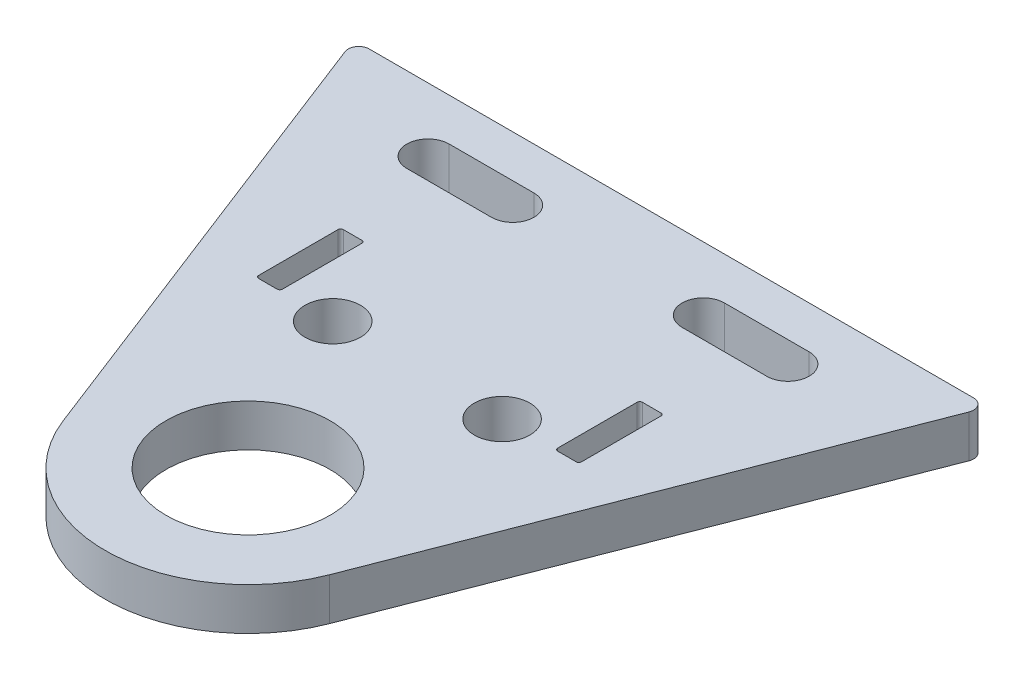
from build123d import *

# Parameters (mm, degrees)
BASE_FLANGE1_DEPTH = 12.7
SKETCH2_R          = 24.60625
SKETCH2_R_2        = 8.3312
CUT_EXTRUDE1_DEPTH = 196.159220654
CUT_EXTRUDE2_DEPTH = 196.159220654
FILLET1_R          = 3.175
SKETCH8_W          = 7.14375
SKETCH8_H          = 25.4
CUT_EXTRUDE3_DEPTH = 195.449637912
FILLET2_R          = 0.79375


# Sheet-metal steps are written as plain solids
with BuildPart() as part:
    # Sketch1 → Base-Flange1 (new body)
    with BuildSketch(Plane(origin=(0, 0, 0), x_dir=(1, 0, 0), z_dir=(0, 1, 0))):
        with BuildLine():
            Line((-95.25, 0), (95.25, 0))
            Line((95.25, 0), (39.960205447, -142.504060335))
            ThreePointArc((39.960205447, -142.504060335), (0, -169.8625), (-39.960205447, -142.504060335))
            Line((-39.960205447, -142.504060335), (-95.25, 0))
        make_face()
    extrude(amount=-BASE_FLANGE1_DEPTH)

    # Sketch2 → Cut-Extrude1 (cut, through all)
    with BuildSketch(Plane(origin=(0, 0, 0), x_dir=(1, 0, 0), z_dir=(0, 1, 0))):
        with Locations(Location((0, -127, 0), (0, 0, 270))):
            Circle(SKETCH2_R)
        with Locations(Location((-25.4, -76.2, 0), (0, 0, 270))):
            Circle(SKETCH2_R_2)
        with Locations(Location((25.4, -76.2, 0), (0, 0, 270))):
            Circle(SKETCH2_R_2)
    extrude(amount=-CUT_EXTRUDE1_DEPTH, mode=Mode.SUBTRACT)

    # Sketch7 → Cut-Extrude2 (cut, through all)
    with BuildSketch(Plane(origin=(0, 0, 0), x_dir=(1, 0, 0), z_dir=(0, 1, 0))):
        with BuildLine():
            Line((53.975, -25.4), (28.575, -25.4))
            ThreePointArc((28.575, -25.4), (22.225, -19.05), (28.575, -12.7))
            Line((28.575, -12.7), (53.975, -12.7))
            ThreePointArc((53.975, -12.7), (60.325, -19.05), (53.975, -25.4))
        make_face()
        with BuildLine():
            Line((-28.575, -25.4), (-53.975, -25.4))
            ThreePointArc((-53.975, -25.4), (-60.325, -19.05), (-53.975, -12.7))
            Line((-53.975, -12.7), (-28.575, -12.7))
            ThreePointArc((-28.575, -12.7), (-22.225, -19.05), (-28.575, -25.4))
        make_face()
    extrude(amount=-CUT_EXTRUDE2_DEPTH, mode=Mode.SUBTRACT)

    # Fillet1
    fillet1_edges = [part.edges().sort_by_distance(p)[0] for p in [
        (-95.25, -6.35, 0),
        (95.25, -6.35, 0),
    ]]
    fillet(fillet1_edges, radius=FILLET1_R)

    # Sketch8 → Cut-Extrude3 (cut, through all)
    with BuildSketch(Plane(origin=(0, 0, 0), x_dir=(1, 0, 0), z_dir=(0, 1, 0))):
        with Locations((44.846875, -63.5)):
            Rectangle(SKETCH8_W, SKETCH8_H)
        with Locations((-44.846875, -63.5)):
            Rectangle(SKETCH8_W, SKETCH8_H)
    extrude(amount=-CUT_EXTRUDE3_DEPTH, mode=Mode.SUBTRACT)

    # Fillet2
    fillet2_edges = [part.edges().sort_by_distance(p)[0] for p in [
        (41.275, -6.35, 76.2),
        (41.275, -6.35, 50.8),
        (48.41875, -6.35, 50.8),
        (48.41875, -6.35, 76.2),
        (-48.41875, -6.35, 76.2),
        (-48.41875, -6.35, 50.8),
        (-41.275, -6.35, 50.8),
        (-41.275, -6.35, 76.2),
    ]]
    fillet(fillet2_edges, radius=FILLET2_R)


solid = part.part
